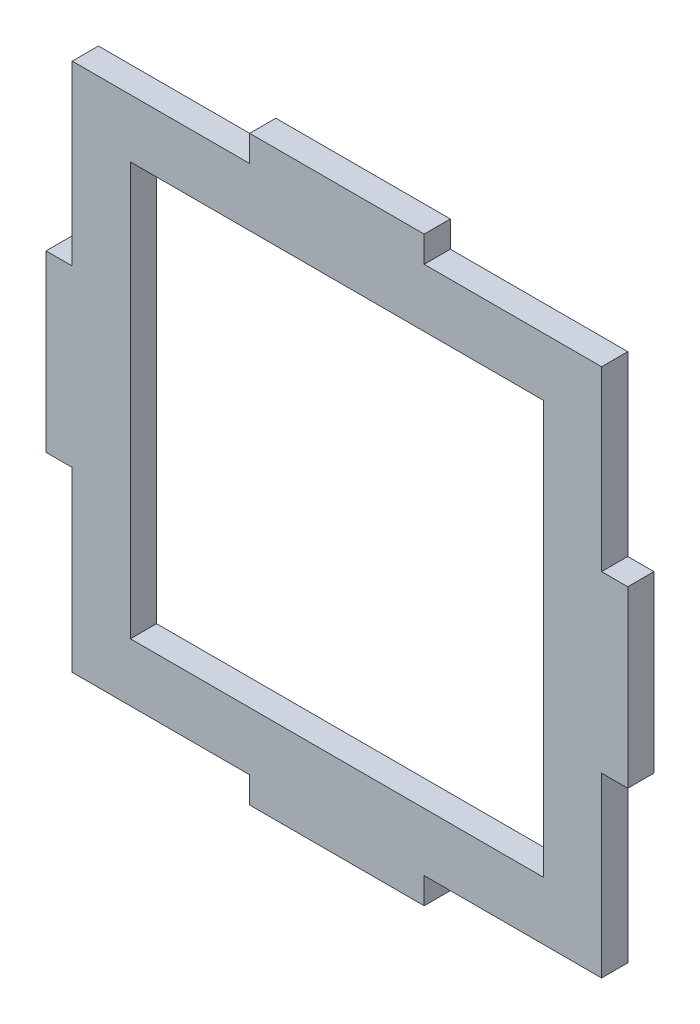
from build123d import *

# Parameters (mm, degrees)
BOSS_EXTRUDE2_DEPTH = 4.5
SKETCH4_W           = 71
SKETCH4_H           = 71
CUT_EXTRUDE1_DEPTH  = 136.132342539


with BuildPart() as part:
    # Sketch3 → Boss-Extrude2 (new body)
    with BuildSketch(Plane.XY):
        Polygon((60.5, 91), (91, 91), (91, 60.5), (95.5, 60.5), (95.5, 30.5), (91, 30.5), (91, 0), (60.5, 0), (60.5, -4.5), (30.5, -4.5), (30.5, 0), (0, 0), (0, 30.5), (-4.5, 30.5), (-4.5, 60.5), (0, 60.5), (0, 91), (30.5, 91), (30.5, 95.5), (60.5, 95.5), align=None)
    extrude(amount=BOSS_EXTRUDE2_DEPTH)

    # Sketch4 → Cut-Extrude1 (cut, through all)
    with BuildSketch(Plane.XY.offset(4.5)):
        with Locations((45.5, 45.5)):
            Rectangle(SKETCH4_W, SKETCH4_H)
    extrude(amount=-CUT_EXTRUDE1_DEPTH, mode=Mode.SUBTRACT)


solid = part.part
